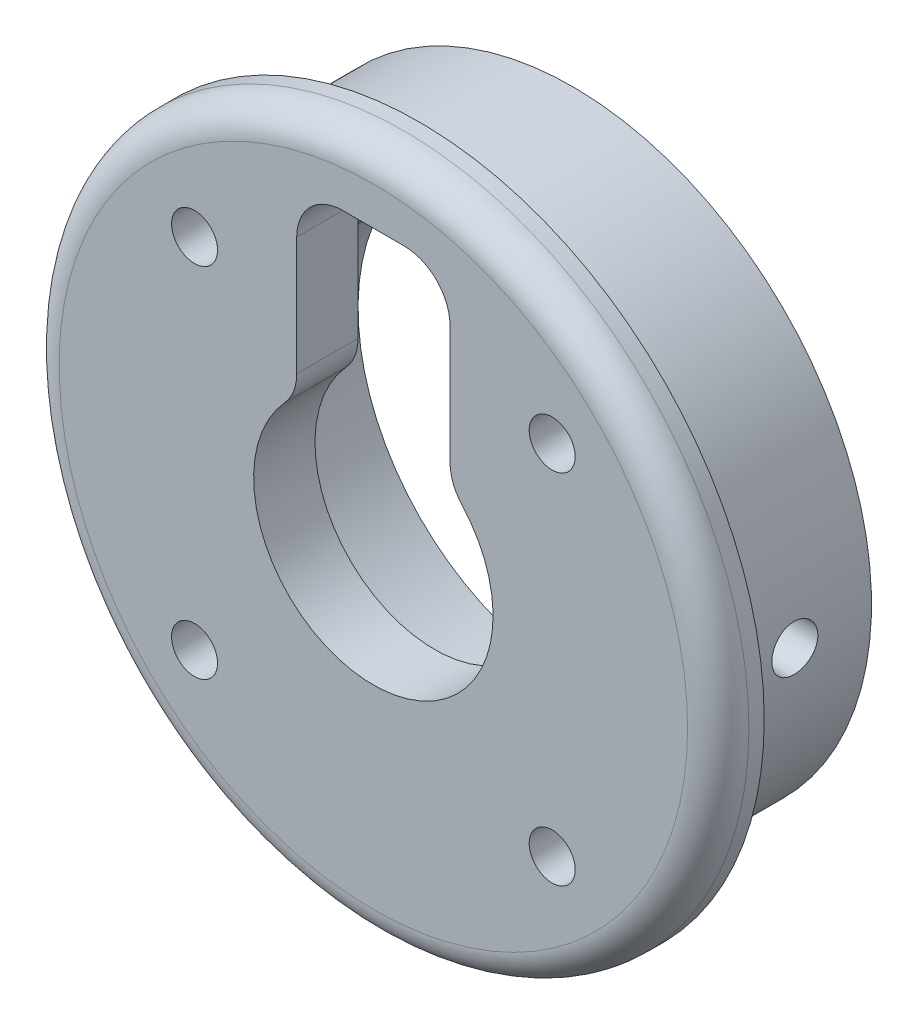
from build123d import *

# Parameters (mm, degrees)
SKETCH1_R               = 22.5
BOSS_EXTRUDE1_DEPTH     = 3
SKETCH2_R               = 19.5
BOSS_EXTRUDE2_DEPTH     = 10
SKETCH3_R               = 1.5
CUT_EXTRUDE1_DEPTH      = 13
CUT_EXTRUDE2_DEPTH      = 60.505474974
CUT_EXTRUDE2_DEPTH_BACK = 60.505474974
SKETCH4_R               = 1.5
SKETCH5_R               = 14
CUT_EXTRUDE3_DEPTH      = 9
FILLET1_R               = 3
FILLET2_R               = 2


with BuildPart() as part:
    # Sketch1 → Boss-Extrude1 (new body)
    with BuildSketch(Plane.XY):
        with Locations((750, 29.313623227)):
            Circle(SKETCH1_R)
    extrude(amount=BOSS_EXTRUDE1_DEPTH)

    # Sketch2 → Boss-Extrude2 (add)
    with BuildSketch(Plane(origin=(0, 0, 0), x_dir=(-1, 0, 0), z_dir=(0, 0, -1))):
        with Locations((-750, 29.313623227)):
            Circle(SKETCH2_R)
    extrude(amount=BOSS_EXTRUDE2_DEPTH)

    # Sketch3 → Cut-Extrude1 (cut)
    with BuildSketch(Plane.XY.offset(3)):
        with Locations((761.66726189, 17.646361337)):
            Circle(SKETCH3_R)
        with Locations((738.33273811, 17.646361337)):
            Circle(SKETCH3_R)
        with Locations((738.33273811, 40.980885116)):
            Circle(SKETCH3_R)
        with Locations((761.66726189, 40.980885116)):
            Circle(SKETCH3_R)
        with BuildLine():
            Line((748, 47.313623227), (752, 47.313623227))
            ThreePointArc((752, 47.313623227), (754.121320344, 46.43494357), (755, 44.313623227))
            Line((755, 44.313623227), (755, 35.313623227))
            ThreePointArc((755, 35.313623227), (750, 21.503373551), (745, 35.313623227))
            Line((745, 35.313623227), (745, 44.313623227))
            ThreePointArc((745, 44.313623227), (745.878679656, 46.43494357), (748, 47.313623227))
        make_face()
    extrude(amount=-CUT_EXTRUDE1_DEPTH, mode=Mode.SUBTRACT)

    # Sketch4 → Cut-Extrude2 (cut, two sides: drawn at the far end of the back side and taken through both)
    with BuildSketch(Plane(origin=(745, 0, 0), x_dir=(0, 0, -1), z_dir=(1, 0, 0)).offset(-CUT_EXTRUDE2_DEPTH_BACK)):
        with Locations((5, 29.313623227)):
            Circle(SKETCH4_R)
    extrude(amount=CUT_EXTRUDE2_DEPTH + CUT_EXTRUDE2_DEPTH_BACK, mode=Mode.SUBTRACT)

    # Sketch5 → Cut-Extrude3 (cut)
    with BuildSketch(Plane(origin=(0, 0, -10), x_dir=(-1, 0, 0), z_dir=(0, 0, -1))):
        with Locations((-750, 29.313623227)):
            Circle(SKETCH5_R)
    extrude(amount=-CUT_EXTRUDE3_DEPTH, mode=Mode.SUBTRACT)

    # Fillet1
    fillet1_edges = [part.edges().sort_by_distance(p)[0] for p in [
        (755, 35.313623227, 1),
        (745, 35.313623227, 1),
        (755, 42.390320057, -5.5),
        (745, 42.390320057, -5.5),
    ]]
    fillet(fillet1_edges, radius=FILLET1_R - 0.0001)  # a hair under: the kernel refuses the full size

    # Fillet2
    fillet2_edges = [part.edges().sort_by_distance(p)[0] for p in [
        (727.5, 29.313623227, 3),
    ]]
    fillet(fillet2_edges, radius=FILLET2_R)


solid = part.part
